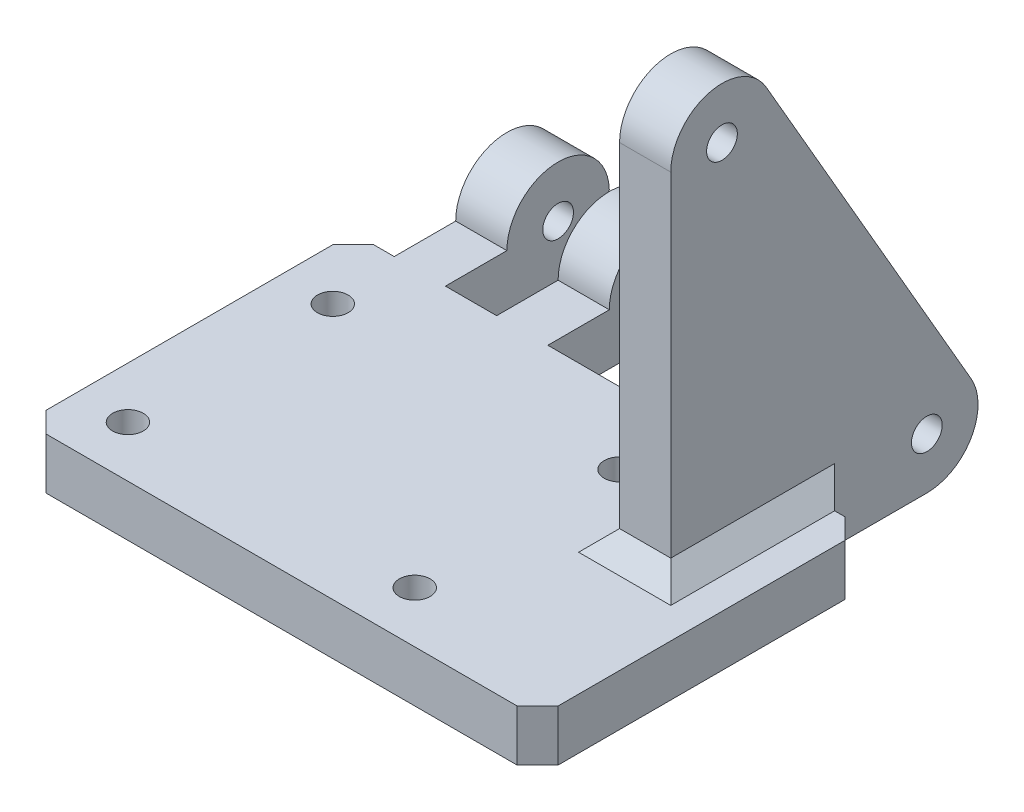
from build123d import *

# Parameters (mm, degrees)
SKETCH_1_W                 = 50
SKETCH_1_H                 = 43
EXTRUDE_1_DEPTH            = 5
EXTRUDE_2_DEPTH            = 5
EXTRUDE_START              = -6
EXTRUDE_3_DEPTH            = 5
EXTRUDE_START_2            = 5
SKETCH_6_R                 = 5
EXTRUDE_4_DEPTH            = 5
SKETCH_7_W                 = 5
SKETCH_7_H                 = 11
SKETCH_7_W_2               = 21
SKETCH_7_W_3               = 4
CUT_EXTRUDE_1_DEPTH        = 54.116947969
CUT_EXTRUDE_2_DEPTH        = 69.138244203
CUT_EXTRUDE_2_DEPTH_BACK   = 69.138244203
SKETCH_9_R                 = 1.5
CHAMFER_1_SIZE             = 2
SKETCH_10_R                = 1.5
CUT_EXTRUDE_3_DEPTH        = 65.944748233
RIB_1_REACH                = 70.138
SKETCH_11_WALL_W           = 172.917504556
SKETCH_11_WALL_H           = 5
CHAMFER_2_SIZE             = 2
HOLE_WIZARD_M3_1_OUTLINE_R = 1.5
HOLE_WIZARD_M3_1_DEPTH     = 5


# Read off the part's stored shape, not the designer's step: M3 螺纹孔1
with BuildPart() as part:
    # 草图1 → 凸台-拉伸1 (new body)
    with BuildSketch(Plane(origin=(0, 0, 0), x_dir=(1, 0, 0), z_dir=(0, 1, 0))):
        with Locations((0, -3.5)):
            Rectangle(SKETCH_1_W, SKETCH_1_H)
    extrude(amount=EXTRUDE_1_DEPTH)

    # 草图3 → 凸台-拉伸2 (add)
    with BuildSketch(Plane(origin=(20, 0, 0), x_dir=(0, 0, -1), z_dir=(1, 0, 0))):
        with BuildLine():
            Line((13.669872981, 2.5), (-6.330127019, 37.141016151))
            ThreePointArc((-6.330127019, 37.141016151), (-4.5, 43.97114317), (2.330127019, 42.141016151))
            Line((2.330127019, 42.141016151), (22.330127019, 7.5))
            ThreePointArc((22.330127019, 7.5), (20.5, 0.669872981), (13.669872981, 2.5))
        make_face()
    extrude(amount=-EXTRUDE_2_DEPTH)

    # 草图5 → 凸台-拉伸3 (add)
    with BuildSketch(Plane(origin=(0, 0, 0), x_dir=(0, 0, -1), z_dir=(1, 0, 0)).offset(EXTRUDE_START)):
        with BuildLine():
            ThreePointArc((22.330127019, 7.5), (13.669872981, 7.5), (18, 0))
            ThreePointArc((18, 0), (21.535533906, 1.464466094), (23, 5))
            ThreePointArc((23, 5), (22.829629131, 6.294095226), (22.330127019, 7.5))
        make_face()
    extrude(amount=-EXTRUDE_3_DEPTH)

    # 草图6 → 凸台-拉伸4 (add)
    with BuildSketch(Plane(origin=(-21, 0, 0), x_dir=(0, 0, -1), z_dir=(1, 0, 0)).offset(EXTRUDE_START_2)):
        with Locations((18, 5)):
            Circle(SKETCH_6_R)
    extrude(amount=-EXTRUDE_4_DEPTH)

    # 草图7 → 切除-拉伸1 (cut, through all)
    with BuildSketch(Plane(origin=(0, 5, 0), x_dir=(1, 0, 0), z_dir=(0, 1, 0))):
        with Locations((-13.5, 12.5)):
            Rectangle(SKETCH_7_W, SKETCH_7_H)
        with Locations((4.5, 12.5)):
            Rectangle(SKETCH_7_W_2, SKETCH_7_H)
        with Locations((22.5, 12.5)):
            Rectangle(SKETCH_7_W, SKETCH_7_H)
        with Locations((-23, 12.5)):
            Rectangle(SKETCH_7_W_3, SKETCH_7_H)
    extrude(amount=-CUT_EXTRUDE_1_DEPTH, mode=Mode.SUBTRACT)

    # 草图9 → 切除-拉伸2 (cut, two sides: drawn at the far end of the back side and taken through both)
    with BuildSketch(Plane(origin=(20, 0, 0), x_dir=(0, 0, -1), z_dir=(1, 0, 0)).offset(-CUT_EXTRUDE_2_DEPTH_BACK)):
        with Locations((18, 5)):
            Circle(SKETCH_9_R)
    extrude(amount=CUT_EXTRUDE_2_DEPTH + CUT_EXTRUDE_2_DEPTH_BACK, mode=Mode.SUBTRACT)

    # 倒角1
    chamfer_1_edges = [part.edges().sort_by_distance(p)[0] for p in [
        (-25, 2.5, -7),
        (25, 2.5, 25),
        (25, 2.5, -7),
        (-25, 2.5, 25),
    ]]
    chamfer(chamfer_1_edges, length=CHAMFER_1_SIZE)

    # 草图10 → 切除-拉伸3 (cut, through all)
    with BuildSketch(Plane.ZY.offset(-15)):
        with Locations((2, 39.641016151)):
            Circle(SKETCH_10_R)
    extrude(amount=-CUT_EXTRUDE_3_DEPTH, mode=Mode.SUBTRACT)

    # 草图11 wall → 筋1 (add, up to next)
    with BuildSketch(Plane(origin=(20, 22.320508076, 7), x_dir=(0, -1, 0), z_dir=(0, 0, -1)), mode=Mode.PRIVATE) as rib_1_sk1:
        with Locations((0, 2.5)):
            Rectangle(SKETCH_11_WALL_W, SKETCH_11_WALL_H)
    rib_1_tool1 = extrude(rib_1_sk1.sketch, amount=RIB_1_REACH, mode=Mode.PRIVATE) - part.part
    add(rib_1_tool1.solids().sort_by_distance((20, 22.320508076, 7))[0])

    # 倒角2
    chamfer_2_edges = [part.edges().sort_by_distance(p)[0] for p in [
        (15, 5, 0),
        (17.5, 5, 7),
        (20, 5, 0),
        (20, 2.5, -7),
        (15, 2.5, -7),
    ]]
    chamfer(chamfer_2_edges, length=CHAMFER_2_SIZE)

    # M3 螺纹孔1 outline → M3 螺纹孔1 (cut)
    with BuildSketch(Plane(origin=(0, 0, 0), x_dir=(1, 0, 0), z_dir=(0, 1, 0))):
        with Locations((8, 0)):
            Circle(HOLE_WIZARD_M3_1_OUTLINE_R)
        with Locations((-20, -20)):
            Circle(HOLE_WIZARD_M3_1_OUTLINE_R)
        with Locations((-20, 0)):
            Circle(HOLE_WIZARD_M3_1_OUTLINE_R)
        with Locations((8, -20)):
            Circle(HOLE_WIZARD_M3_1_OUTLINE_R)
    extrude(amount=HOLE_WIZARD_M3_1_DEPTH, mode=Mode.SUBTRACT)


solid = part.part
